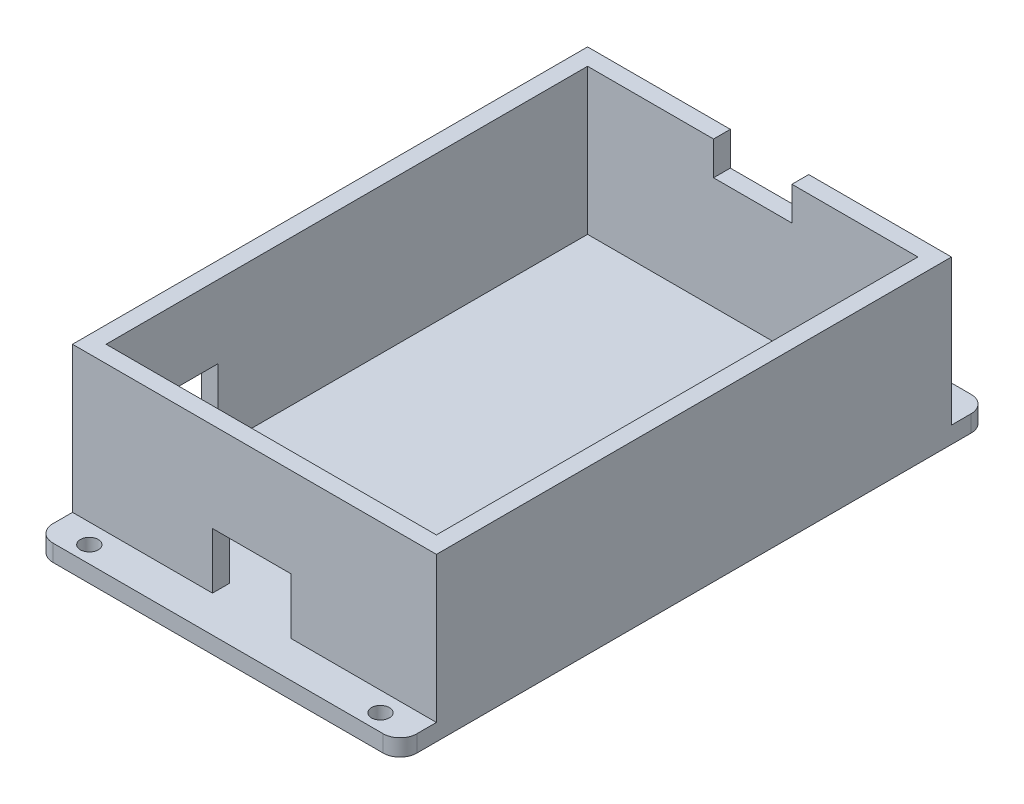
from build123d import *

# Parameters (mm, degrees)
SKETCH_1_W               = 65
SKETCH_1_H               = 92
SKETCH_1_W_2             = 59
SKETCH_1_H_2             = 86
EXTRUDE_1_DEPTH          = 26
SKETCH_2_W               = 65
SKETCH_2_H               = 105
EXTRUDE_2_DEPTH          = 3
CUT_EXTRUDE_1_DEPTH      = 67.996268553
CUT_EXTRUDE_1_DEPTH_BACK = 67.996268553
SKETCH_3_R               = 1.6
FILLET_1_R               = 3
CUT_EXTRUDE_START        = -3
CUT_EXTRUDE_2_OUTLINE_W  = 14
CUT_EXTRUDE_2_OUTLINE_H  = 10
CUT_EXTRUDE_2_DEPTH      = 3
CUT_EXTRUDE_3_OUTLINE_W  = 10
CUT_EXTRUDE_3_OUTLINE_H  = 11
CUT_EXTRUDE_3_DEPTH      = 3
SKETCH_6_W               = 14
SKETCH_6_H               = 6
CUT_EXTRUDE_4_DEPTH      = 10


# Read off the part's stored shape, not the designer's step: 切除-拉伸2, 切除-拉伸3
with BuildPart() as part:
    # 草图1 → 凸台-拉伸1 (new body)
    with BuildSketch(Plane(origin=(0, 0, 0), x_dir=(1, 0, 0), z_dir=(0, 1, 0))):
        Rectangle(SKETCH_1_W, SKETCH_1_H)
        Rectangle(SKETCH_1_W_2, SKETCH_1_H_2, mode=Mode.SUBTRACT)
    extrude(amount=EXTRUDE_1_DEPTH)

    # 草图2 → 凸台-拉伸2 (add)
    with BuildSketch(Plane.XZ):
        Rectangle(SKETCH_2_W, SKETCH_2_H)
    extrude(amount=EXTRUDE_2_DEPTH)

    # 草图3 → 切除-拉伸1 (cut, two sides: drawn at the far end of the back side and taken through both)
    with BuildSketch(Plane(origin=(0, 0, 0), x_dir=(1, 0, 0), z_dir=(0, 1, 0)).offset(-CUT_EXTRUDE_1_DEPTH_BACK)):
        with Locations(Location((-26, 49.5, 0), (0, 0, 270))):
            Circle(SKETCH_3_R)
        with Locations(Location((26, 49.5, 0), (0, 0, 270))):
            Circle(SKETCH_3_R)
        with Locations(Location((26, -49.5, 0), (0, 0, 270))):
            Circle(SKETCH_3_R)
        with Locations(Location((-26, -49.5, 0), (0, 0, 270))):
            Circle(SKETCH_3_R)
    extrude(amount=CUT_EXTRUDE_1_DEPTH + CUT_EXTRUDE_1_DEPTH_BACK, mode=Mode.SUBTRACT)

    # 圆角1
    fillet_1_edges = [part.edges().sort_by_distance(p)[0] for p in [
        (32.5, -1.5, -52.5),
        (32.5, -1.5, 52.5),
        (-32.5, -1.5, 52.5),
        (-32.5, -1.5, -52.5),
    ]]
    fillet(fillet_1_edges, radius=FILLET_1_R)

    # 切除-拉伸2 outline → 切除-拉伸2 (cut)
    with BuildSketch(Plane(origin=(0, 0, 43), x_dir=(-1, 0, 0), z_dir=(0, 0, -1)).offset(CUT_EXTRUDE_START)):
        with Locations((0.5, 5)):
            Rectangle(CUT_EXTRUDE_2_OUTLINE_W, CUT_EXTRUDE_2_OUTLINE_H)
    extrude(amount=CUT_EXTRUDE_2_DEPTH, mode=Mode.SUBTRACT)

    # 切除-拉伸3 outline → 切除-拉伸3 (cut)
    with BuildSketch(Plane(origin=(-29.5, 0, 0), x_dir=(0, 0, -1), z_dir=(1, 0, 0)).offset(CUT_EXTRUDE_START)):
        with Locations((-28, 7.5)):
            Rectangle(CUT_EXTRUDE_3_OUTLINE_W, CUT_EXTRUDE_3_OUTLINE_H)
    extrude(amount=CUT_EXTRUDE_3_DEPTH, mode=Mode.SUBTRACT)

    # 草图6 → 切除-拉伸4 (cut)
    with BuildSketch(Plane(origin=(0, 0, -46), x_dir=(-1, 0, 0), z_dir=(0, 0, -1))):
        with Locations((0, 23)):
            Rectangle(SKETCH_6_W, SKETCH_6_H)
    extrude(amount=-CUT_EXTRUDE_4_DEPTH, mode=Mode.SUBTRACT)


solid = part.part
